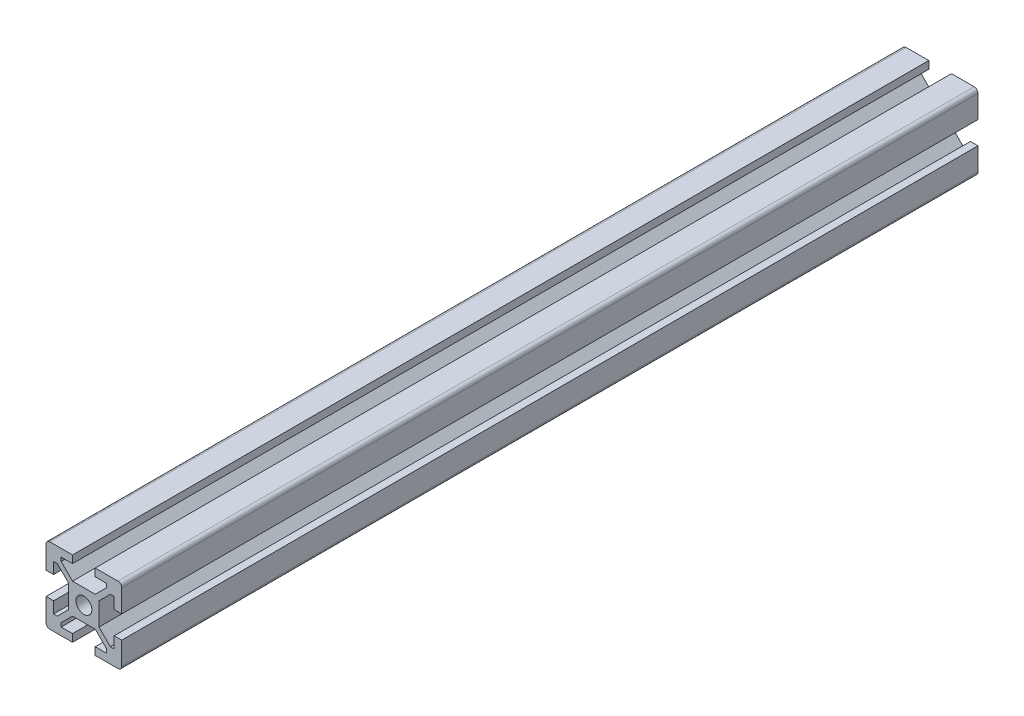
from build123d import *

# Parameters (mm, degrees)
SKETCH1_R           = 2.1
BOSS_EXTRUDE1_DEPTH = 226.15


with BuildPart() as part:
    # Sketch1 → Boss-Extrude1 (new body)
    with BuildSketch(Plane(origin=(0, 0, 0), x_dir=(-1, 0, 0), z_dir=(0, 0, -1))):
        with BuildLine():
            Line((6, -8), (3, -8))
            Line((3, -8), (3, -10))
            Line((3, -10), (9, -10))
            ThreePointArc((9, -10), (9.707106781, -9.707106781), (10, -9))
            Line((10, -9), (10, -3))
            Line((10, -3), (8, -3))
            Line((8, -3), (8, -6))
            Line((8, -6), (7, -6))
            Line((7, -6), (4, -3))
            Line((4, -3), (4, 3))
            Line((4, 3), (7, 6))
            Line((7, 6), (8, 6))
            Line((8, 6), (8, 3))
            Line((8, 3), (10, 3))
            Line((10, 3), (10, 9))
            ThreePointArc((10, 9), (9.707106781, 9.707106781), (9, 10))
            Line((9, 10), (3, 10))
            Line((3, 10), (3, 8))
            Line((3, 8), (6, 8))
            Line((6, 8), (6, 7))
            Line((6, 7), (3, 4))
            Line((3, 4), (-3, 4))
            Line((-3, 4), (-6, 7))
            Line((-6, 7), (-6, 8))
            Line((-6, 8), (-3, 8))
            Line((-3, 8), (-3, 10))
            Line((-3, 10), (-9, 10))
            ThreePointArc((-9, 10), (-9.707106781, 9.707106781), (-10, 9))
            Line((-10, 9), (-10, 3))
            Line((-10, 3), (-8, 3))
            Line((-8, 3), (-8, 6))
            Line((-8, 6), (-7, 6))
            Line((-7, 6), (-4, 3))
            Line((-4, 3), (-4, -3))
            Line((-4, -3), (-7, -6))
            Line((-7, -6), (-8, -6))
            Line((-8, -6), (-8, -3))
            Line((-8, -3), (-10, -3))
            Line((-10, -3), (-10, -9))
            ThreePointArc((-10, -9), (-9.707106781, -9.707106781), (-9, -10))
            Line((-9, -10), (-3, -10))
            Line((-3, -10), (-3, -8))
            Line((-3, -8), (-6, -8))
            Line((-6, -8), (-6, -7))
            Line((-6, -7), (-3, -4))
            Line((-3, -4), (3, -4))
            Line((3, -4), (6, -7))
            Line((6, -7), (6, -8))
        make_face()
        Circle(SKETCH1_R, mode=Mode.SUBTRACT)
    extrude(amount=-BOSS_EXTRUDE1_DEPTH)


solid = part.part
